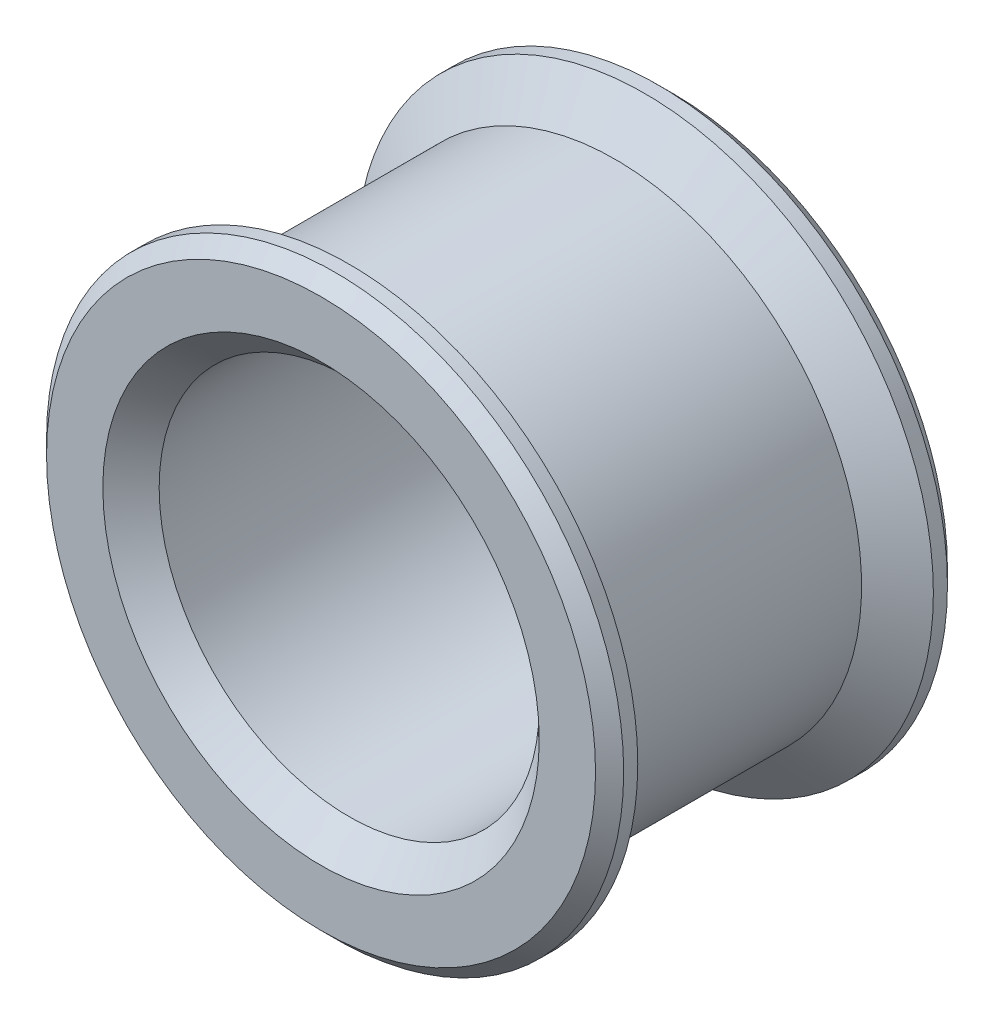
from build123d import *

# Parameters (mm, degrees)
SKETCH1_R           = 8.75
SKETCH1_R_2         = 6.75
BOSS_EXTRUDE1_DEPTH = 5.25
SKETCH2_R           = 10.25
SKETCH2_R_2         = 6.75
BOSS_EXTRUDE2_DEPTH = 1
CHAMFER1_SIZE       = 1.050311307
CHAMFER1_SIZE_2     = 1.5
CHAMFER2_SIZE       = 1
CHAMFER3_SIZE       = 0.5


with BuildPart() as part:
    # Sketch1 → Boss-Extrude1 (new, symmetric)
    with BuildSketch(Plane.XY):
        with Locations(Location((0, 0, 0), (0, 0, 180))):
            Circle(SKETCH1_R)
        with Locations(Location((0, 0, 0), (0, 0, 180))):
            Circle(SKETCH1_R_2, mode=Mode.SUBTRACT)
    extrude(amount=BOSS_EXTRUDE1_DEPTH, both=True)

    # Sketch2 → Boss-Extrude2 (add)
    with BuildSketch(Plane.XY.offset(5.25)):
        Circle(SKETCH2_R)
        with Locations(Location((0, 0, 0), (0, 0, 180))):
            Circle(SKETCH2_R_2, mode=Mode.SUBTRACT)
    boss_extrude2 = extrude(amount=BOSS_EXTRUDE2_DEPTH)

    # Mirror1: Boss-Extrude2 across plane
    add(boss_extrude2.mirror(Plane.XY))

    # Chamfer1
    # the kernel refuses this chamfer: 1.5, 1.050311307 mm, written as the material it adds along each edge
    with BuildSketch(Plane(origin=(0, 0, -5.25), x_dir=(-1, 0, 0), z_dir=(0, 1, 0))) as chamfer1_piece_1_section:
        Polygon((8.75, CHAMFER1_SIZE), (8.75 + CHAMFER1_SIZE_2, 0), (8.75, 0), align=None)
    chamfer1_piece_1 = revolve(axis=Axis((0, 0, -5.25), (0, 0, 1)), mode=Mode.PRIVATE)
    chamfer1_piece_1 = chamfer1_piece_1 & Plane(origin=(0, 0, -4.738052243), x_dir=(1, 0, 0), z_dir=(0, 0, 1)) * Cylinder(10.25, 42, mode=Mode.PRIVATE)
    add(chamfer1_piece_1)
    with BuildSketch(Plane(origin=(0, 0, 5.25), x_dir=(-1, 0, 0), z_dir=(0, 1, 0))) as chamfer1_piece_2_section:
        Polygon((8.75, -CHAMFER1_SIZE), (8.75 + CHAMFER1_SIZE_2, 0), (8.75, 0), align=None)
    chamfer1_piece_2 = revolve(axis=Axis((0, 0, 5.25), (0, 0, 1)), mode=Mode.PRIVATE)
    chamfer1_piece_2 = chamfer1_piece_2 & Plane(origin=(0, 0, 4.738052243), x_dir=(1, 0, 0), z_dir=(0, 0, -1)) * Cylinder(10.25, 42, mode=Mode.PRIVATE)
    add(chamfer1_piece_2)

    # Chamfer2
    chamfer2_edges = [part.edges().sort_by_distance(p)[0] for p in [
        (6.75, 0, 6.25),
        (6.75, 0, -6.25),
    ]]
    chamfer(chamfer2_edges, length=CHAMFER2_SIZE)

    # Chamfer3
    chamfer3_edges = [part.edges().sort_by_distance(p)[0] for p in [
        (-10.25, 0, 6.25),
        (-10.25, 0, -6.25),
    ]]
    chamfer(chamfer3_edges, length=CHAMFER3_SIZE)


solid = part.part
